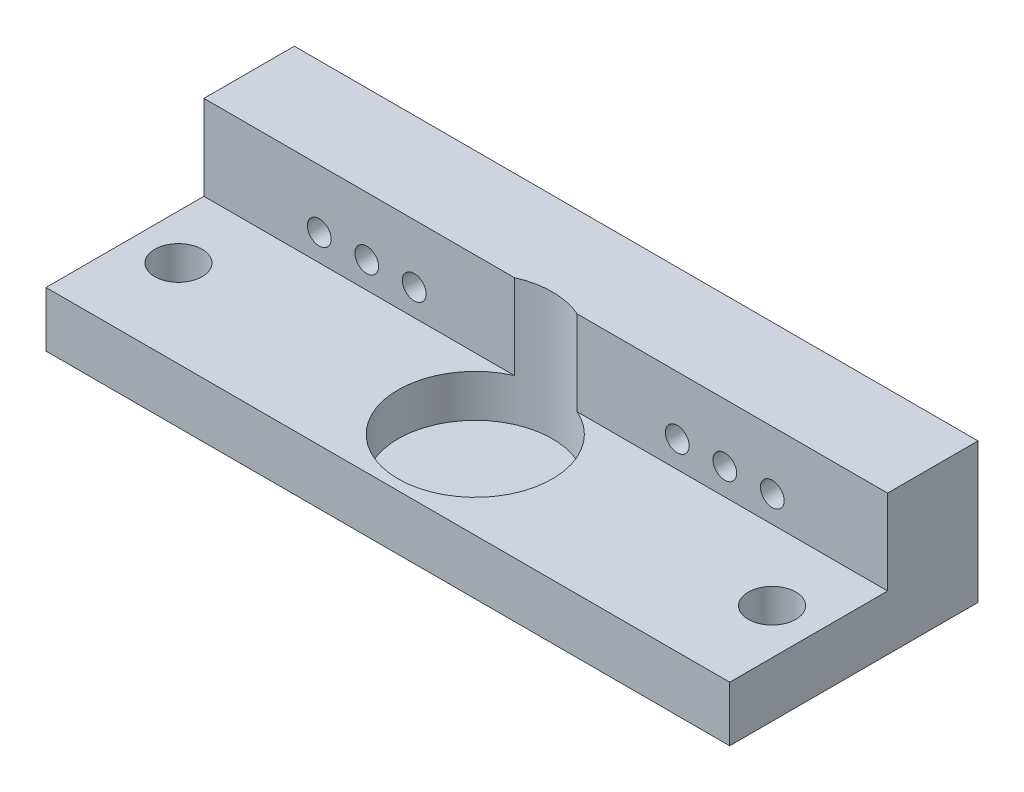
from build123d import *

# Parameters (mm, degrees)
SKETCH1_W           = 102.39
SKETCH1_H           = 26.19
BOSS_EXTRUDE1_DEPTH = 1.905
SKETCH2_W           = 102.39
SKETCH2_H           = 26.19
SKETCH2_R           = 3.556
SKETCH2_R_2         = 11.557
BOSS_EXTRUDE3_DEPTH = 6.35
BOSS_EXTRUDE4_DEPTH = 12.7
CUT_EXTRUDE1_REACH  = 63.204
SKETCH4_R           = 1.778
BOSS_EXTRUDE5_START = 11
SKETCH5_W           = 102.39
SKETCH5_H           = 20.955
SKETCH5_R           = 1.778
BOSS_EXTRUDE5_DEPTH = 11


with BuildPart() as part:
    # Sketch1 → Boss-Extrude1 (new body)
    with BuildSketch(Plane(origin=(0, 0, 0), x_dir=(1, 0, 0), z_dir=(0, 1, 0))):
        Rectangle(SKETCH1_W, SKETCH1_H)
    extrude(amount=BOSS_EXTRUDE1_DEPTH)

    # Sketch2 → Boss-Extrude3 (add)
    with BuildSketch(Plane(origin=(0, 1.905, 0), x_dir=(1, 0, 0), z_dir=(0, 1, 0))):
        Rectangle(SKETCH2_W, SKETCH2_H)
        with Locations((-44.45, 0)):
            Circle(SKETCH2_R, mode=Mode.SUBTRACT)
        Circle(SKETCH2_R_2, mode=Mode.SUBTRACT)
        with Locations((44.45, 0)):
            Circle(SKETCH2_R, mode=Mode.SUBTRACT)
    extrude(amount=BOSS_EXTRUDE3_DEPTH)

    # Sketch3 → Boss-Extrude4 (add)
    with BuildSketch(Plane(origin=(0, 8.255, 0), x_dir=(1, 0, 0), z_dir=(0, 1, 0))):
        with BuildLine():
            Line((-51.195, 13.095), (51.195, 13.095))
            Line((51.195, 13.095), (51.195, 10.555))
            Line((51.195, 10.555), (4.707039834, 10.555))
            ThreePointArc((4.707039834, 10.555), (0, 11.557), (-4.707039834, 10.555))
            Line((-4.707039834, 10.555), (-51.195, 10.555))
            Line((-51.195, 10.555), (-51.195, 13.095))
        make_face()
    extrude(amount=BOSS_EXTRUDE4_DEPTH)

    # Sketch4 → Cut-Extrude1 (cut, up to next)
    with BuildSketch(Plane(origin=(0, 0, -13.095), x_dir=(-1, 0, 0), z_dir=(0, 0, -1)), mode=Mode.PRIVATE) as cut_extrude1_sk1:
        with Locations((-33.923, 12.211)):
            Circle(SKETCH4_R)
    cut_extrude1_tool1 = extrude(cut_extrude1_sk1.sketch, amount=-CUT_EXTRUDE1_REACH, mode=Mode.PRIVATE) & part.part
    # Sketch4 → Cut-Extrude1 (cut, up to next)
    with BuildSketch(Plane(origin=(0, 0, -13.095), x_dir=(-1, 0, 0), z_dir=(0, 0, -1)), mode=Mode.PRIVATE) as cut_extrude1_sk2:
        with Locations((-26.811, 12.211)):
            Circle(SKETCH4_R)
    cut_extrude1_tool2 = extrude(cut_extrude1_sk2.sketch, amount=-CUT_EXTRUDE1_REACH, mode=Mode.PRIVATE) & part.part
    # Sketch4 → Cut-Extrude1 (cut, up to next)
    with BuildSketch(Plane(origin=(0, 0, -13.095), x_dir=(-1, 0, 0), z_dir=(0, 0, -1)), mode=Mode.PRIVATE) as cut_extrude1_sk3:
        with Locations((-19.699, 12.211)):
            Circle(SKETCH4_R)
    cut_extrude1_tool3 = extrude(cut_extrude1_sk3.sketch, amount=-CUT_EXTRUDE1_REACH, mode=Mode.PRIVATE) & part.part
    # Sketch4 → Cut-Extrude1 (cut, up to next)
    with BuildSketch(Plane(origin=(0, 0, -13.095), x_dir=(-1, 0, 0), z_dir=(0, 0, -1)), mode=Mode.PRIVATE) as cut_extrude1_sk4:
        with Locations((19.699, 12.211)):
            Circle(SKETCH4_R)
    cut_extrude1_tool4 = extrude(cut_extrude1_sk4.sketch, amount=-CUT_EXTRUDE1_REACH, mode=Mode.PRIVATE) & part.part
    # Sketch4 → Cut-Extrude1 (cut, up to next)
    with BuildSketch(Plane(origin=(0, 0, -13.095), x_dir=(-1, 0, 0), z_dir=(0, 0, -1)), mode=Mode.PRIVATE) as cut_extrude1_sk5:
        with Locations((26.811, 12.211)):
            Circle(SKETCH4_R)
    cut_extrude1_tool5 = extrude(cut_extrude1_sk5.sketch, amount=-CUT_EXTRUDE1_REACH, mode=Mode.PRIVATE) & part.part
    # Sketch4 → Cut-Extrude1 (cut, up to next)
    with BuildSketch(Plane(origin=(0, 0, -13.095), x_dir=(-1, 0, 0), z_dir=(0, 0, -1)), mode=Mode.PRIVATE) as cut_extrude1_sk6:
        with Locations((33.923, 12.211)):
            Circle(SKETCH4_R)
    cut_extrude1_tool6 = extrude(cut_extrude1_sk6.sketch, amount=-CUT_EXTRUDE1_REACH, mode=Mode.PRIVATE) & part.part
    add(cut_extrude1_tool1.solids().sort_by_distance((33.923, 12.211, -13.095))[0], mode=Mode.SUBTRACT)
    add(cut_extrude1_tool2.solids().sort_by_distance((26.811, 12.211, -13.095))[0], mode=Mode.SUBTRACT)
    add(cut_extrude1_tool3.solids().sort_by_distance((19.699, 12.211, -13.095))[0], mode=Mode.SUBTRACT)
    add(cut_extrude1_tool4.solids().sort_by_distance((-19.699, 12.211, -13.095))[0], mode=Mode.SUBTRACT)
    add(cut_extrude1_tool5.solids().sort_by_distance((-26.811, 12.211, -13.095))[0], mode=Mode.SUBTRACT)
    add(cut_extrude1_tool6.solids().sort_by_distance((-33.923, 12.211, -13.095))[0], mode=Mode.SUBTRACT)

    # Sketch5 → Boss-Extrude5 (add)
    with BuildSketch(Plane(origin=(0, 0, -13.095), x_dir=(-1, 0, 0), z_dir=(0, 0, -1)).offset(BOSS_EXTRUDE5_START)):
        with Locations((0, 10.4775)):
            Rectangle(SKETCH5_W, SKETCH5_H)
        with Locations((33.923, 12.211)):
            Circle(SKETCH5_R, mode=Mode.SUBTRACT)
        with Locations((26.811, 12.211)):
            Circle(SKETCH5_R, mode=Mode.SUBTRACT)
        with Locations((19.699, 12.211)):
            Circle(SKETCH5_R, mode=Mode.SUBTRACT)
        with Locations((-19.699, 12.211)):
            Circle(SKETCH5_R, mode=Mode.SUBTRACT)
        with Locations((-26.811, 12.211)):
            Circle(SKETCH5_R, mode=Mode.SUBTRACT)
        with Locations((-33.923, 12.211)):
            Circle(SKETCH5_R, mode=Mode.SUBTRACT)
    extrude(amount=-BOSS_EXTRUDE5_DEPTH)


solid = part.part
